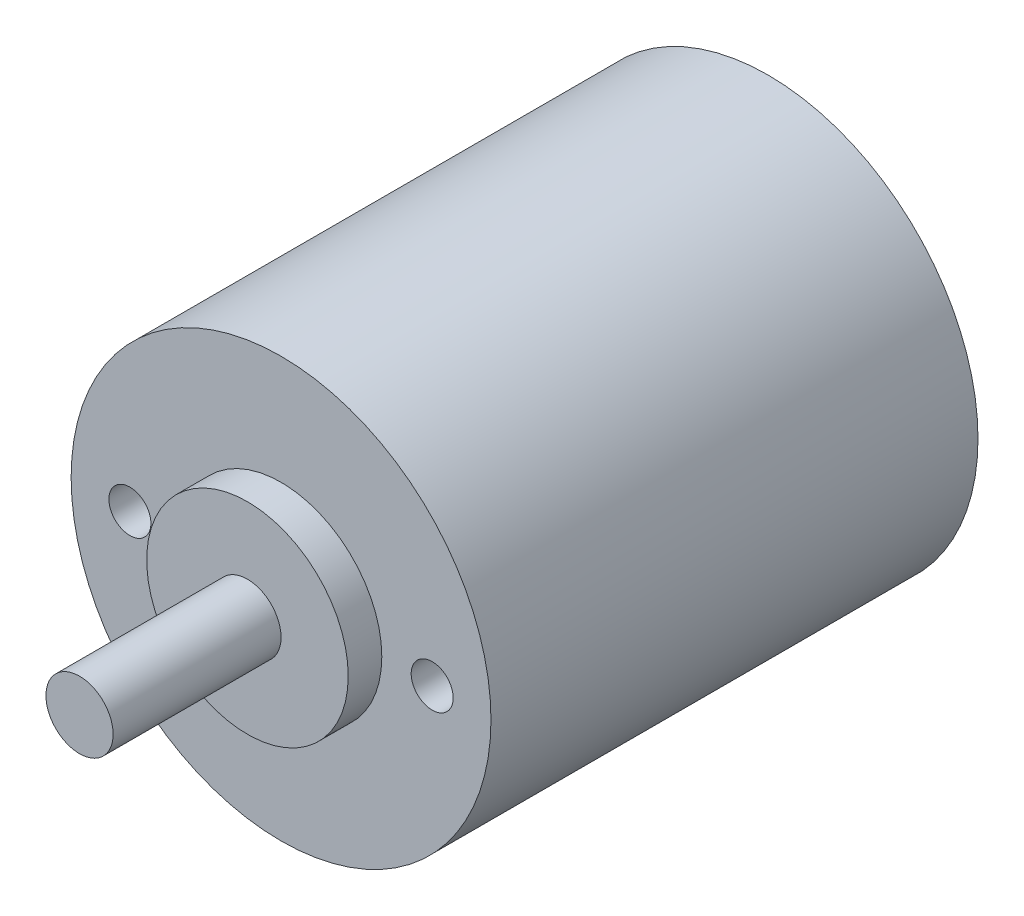
from build123d import *

# Parameters (mm, degrees)
SKETCH1_R                 = 12.5
BOSS_EXTRUDE1_DEPTH       = 29
SKETCH2_R                 = 2
BOSS_EXTRUDE2_DEPTH       = 12
SKETCH3_R                 = 6
BOSS_EXTRUDE3_DEPTH       = 2
M3X0_5_TAPPED_HOLE1_D     = 2.5
M3X0_5_TAPPED_HOLE1_DEPTH = 4
M3X0_5_TAPPED_HOLE1_TIP   = 0.751075774


with BuildPart() as part:
    # Sketch1 → Boss-Extrude1 (new body)
    with BuildSketch(Plane.XY):
        Circle(SKETCH1_R)
    extrude(amount=BOSS_EXTRUDE1_DEPTH)

    # Sketch2 → Boss-Extrude2 (add)
    with BuildSketch(Plane.XY.offset(29)):
        Circle(SKETCH2_R)
    extrude(amount=BOSS_EXTRUDE2_DEPTH)

    # Sketch3 → Boss-Extrude3 (add)
    with BuildSketch(Plane.XY.offset(29)):
        Circle(SKETCH3_R)
    extrude(amount=BOSS_EXTRUDE3_DEPTH)

    # M3x0.5 Tapped Hole1
    with Locations(Plane.XY.offset(29)):
        with Locations((-9, 0), (9, 0)):
            Hole(M3X0_5_TAPPED_HOLE1_D / 2, depth=M3X0_5_TAPPED_HOLE1_DEPTH)
            with Locations((0, 0, -(M3X0_5_TAPPED_HOLE1_DEPTH + M3X0_5_TAPPED_HOLE1_TIP / 2))):  # 118° drill point
                Cone(0, M3X0_5_TAPPED_HOLE1_D / 2, M3X0_5_TAPPED_HOLE1_TIP, mode=Mode.SUBTRACT)


solid = part.part
